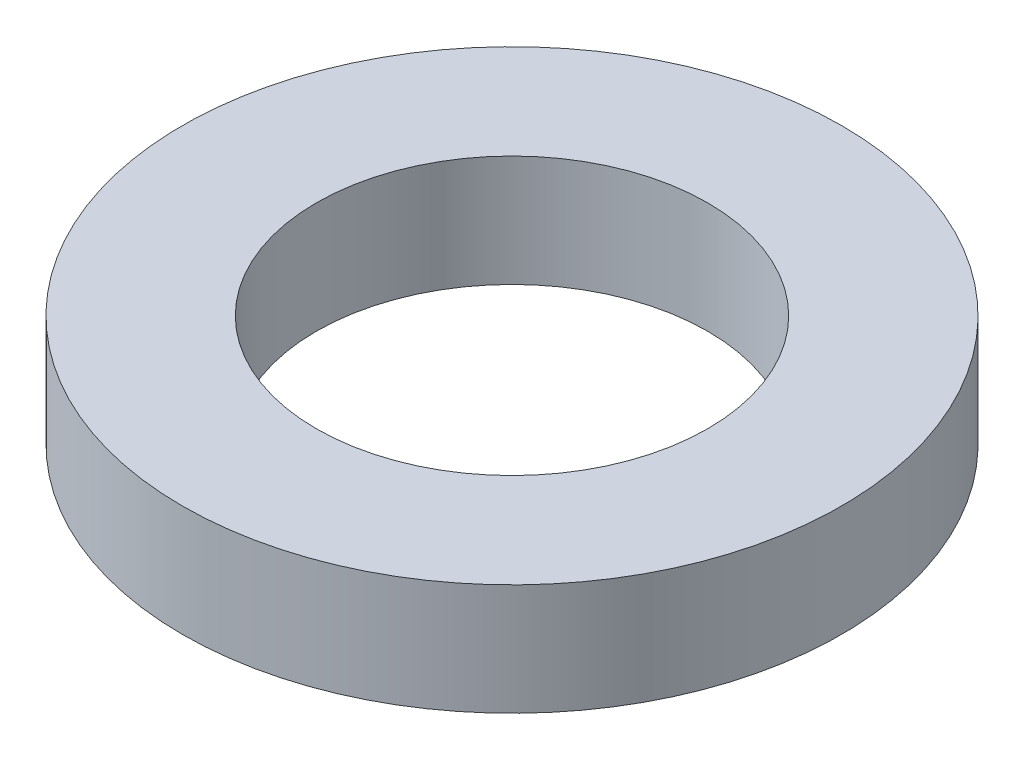
from build123d import *

# Parameters (mm, degrees)
SKETCH1_R           = 80
BOSS_EXTRUDE1_DEPTH = 27
SKETCH2_R           = 47.5
CUT_EXTRUDE1_DEPTH  = 117.314229568


with BuildPart() as part:
    # Sketch1 → Boss-Extrude1 (new body)
    with BuildSketch(Plane(origin=(0, 0, 0), x_dir=(1, 0, 0), z_dir=(0, 1, 0))):
        Circle(SKETCH1_R)
    extrude(amount=BOSS_EXTRUDE1_DEPTH)

    # Sketch2 → Cut-Extrude1 (cut, through all)
    with BuildSketch(Plane(origin=(0, 0, 0), x_dir=(1, 0, 0), z_dir=(0, 1, 0))):
        Circle(SKETCH2_R)
    extrude(amount=CUT_EXTRUDE1_DEPTH, mode=Mode.SUBTRACT)


solid = part.part
